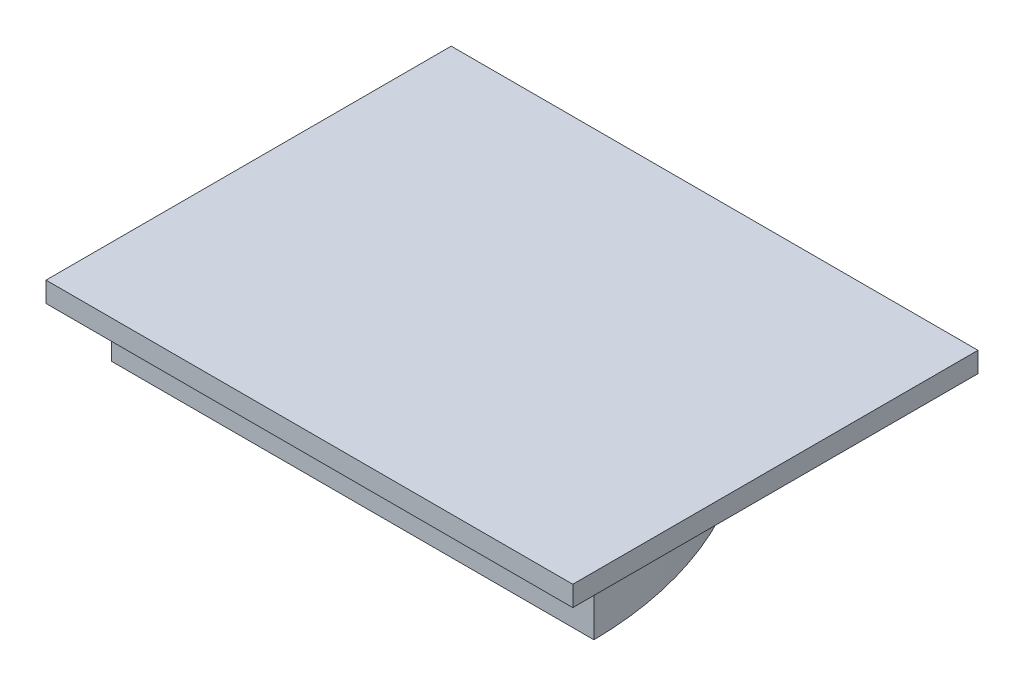
from build123d import *

# Parameters (mm, degrees)
SKETCH1_W           = 23.8
SKETCH1_H           = 18
BOSS_EXTRUDE1_DEPTH = 3
FILLET1_R           = 18.2
SKETCH2_W           = 26
SKETCH2_H           = 20
BOSS_EXTRUDE2_DEPTH = 1


with BuildPart() as part:
    # Sketch1 → Boss-Extrude1 (new body)
    with BuildSketch(Plane(origin=(0, 0, 0), x_dir=(1, 0, 0), z_dir=(0, 1, 0))):
        with Locations((-12.277059049, -1.117021277)):
            Rectangle(SKETCH1_W, SKETCH1_H)
    extrude(amount=BOSS_EXTRUDE1_DEPTH)

    # Fillet1
    # the kernel refuses this fillet: 18.2 mm, written as the material it takes off along each edge
    with BuildSketch(Plane(origin=(-24.177059049, -45.497252664, -7.882978723), x_dir=(1, 0, 0), z_dir=(0, 1, 0))) as fillet1_piece_1:
        with BuildLine():
            CenterArc((18.198901066, -18.2), FILLET1_R, 90, 89.370363377)
            Line((0, -18), (-0.363978021, -17.996))
            ThreePointArc((-0.363978021, -17.996), (-0.364, -9), (-0.364, 0))
            Line((-0.364, 0), (0, 0.364))
            Line((0, 0.364), (18.198901066, 0.364))
            Line((18.198901066, 0.364), (18.198901066, 0))
        make_face()
    extrude(amount=93.994505329, mode=Mode.SUBTRACT)
    with BuildSketch(Plane(origin=(-0.377059049, -45.497252664, -7.882978723), x_dir=(-1, 0, 0), z_dir=(0, 1, 0))) as fillet1_piece_2:
        with BuildLine():
            CenterArc((18.198901066, 18.2), FILLET1_R, 180.629636623, 89.370363377)
            Line((0, 18), (-0.363978021, 17.996))
            ThreePointArc((-0.363978021, 17.996), (-0.364, 9), (-0.364, 0))
            Line((-0.364, 0), (0, -0.364))
            Line((0, -0.364), (18.198901066, -0.364))
            Line((18.198901066, -0.364), (18.198901066, 0))
        make_face()
    extrude(amount=93.994505329, mode=Mode.SUBTRACT)

    # Sketch2 → Boss-Extrude2 (add)
    with BuildSketch(Plane(origin=(0, 3, 0), x_dir=(1, 0, 0), z_dir=(0, 1, 0))):
        with Locations((-12.277059049, -2.262026244)):
            Rectangle(SKETCH2_W, SKETCH2_H)
    extrude(amount=BOSS_EXTRUDE2_DEPTH)


solid = part.part
